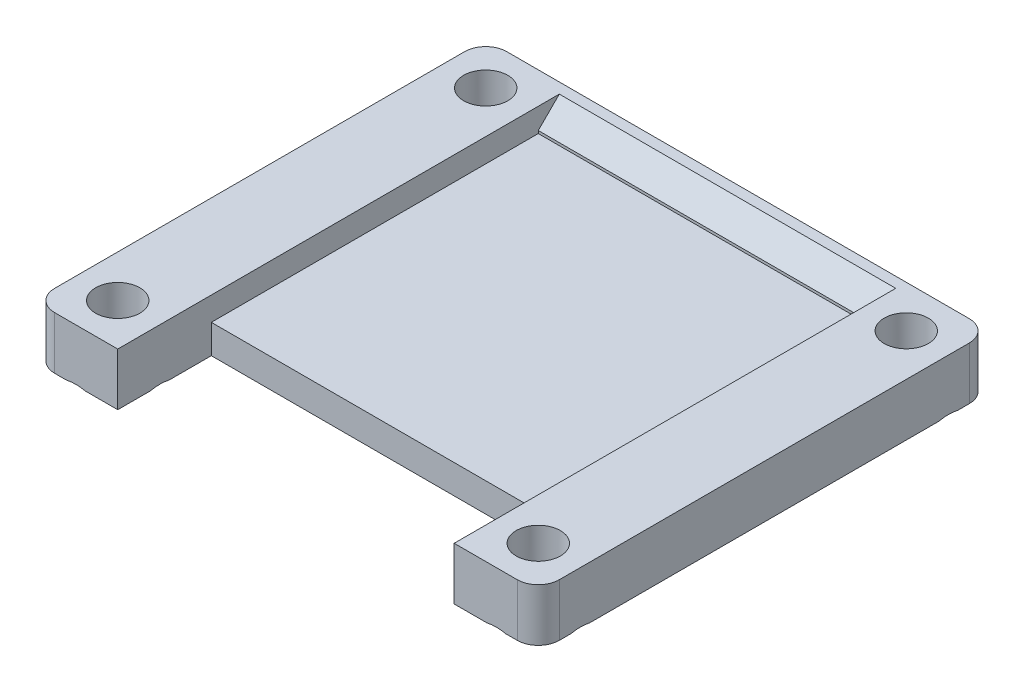
from build123d import *

# Parameters (mm, degrees)
SKETCH_1_W          = 48
SKETCH_1_H          = 43
EXTRUDE_1_DEPTH     = 5
SKETCH_2_W          = 32
SKETCH_2_H          = 40
CUT_EXTRUDE_1_DEPTH = 2.25
SKETCH_3_R          = 2.1
CUT_EXTRUDE_2_DEPTH = 65.637450445
CHAMFER_1_SIZE      = 2
FILLET_1_R          = 2
CHAMFER_2_SIZE      = 2
SKETCH_4_W          = 32
SKETCH_4_H          = 8.9
CUT_EXTRUDE_3_DEPTH = 65.502422435


with BuildPart() as part:
    # Эскиз1 → Бобышка-Вытянуть1 (new body)
    with BuildSketch(Plane(origin=(0, 0, 0), x_dir=(1, 0, 0), z_dir=(0, 1, 0))):
        with Locations((-24, 21.5)):
            Rectangle(SKETCH_1_W, SKETCH_1_H)
    extrude(amount=-EXTRUDE_1_DEPTH)

    # Эскиз2 → Вырез-Вытянуть1 (cut)
    with BuildSketch(Plane(origin=(0, 0, 0), x_dir=(1, 0, 0), z_dir=(0, 1, 0))):
        with Locations((-24, 20)):
            Rectangle(SKETCH_2_W, SKETCH_2_H)
    extrude(amount=-CUT_EXTRUDE_1_DEPTH, mode=Mode.SUBTRACT)

    # Эскиз3 → Вырез-Вытянуть2 (cut, through all)
    with BuildSketch(Plane(origin=(0, 0, 0), x_dir=(1, 0, 0), z_dir=(0, 1, 0))):
        with Locations(Location((-44, 39, 0), (0, 0, 270))):
            Circle(SKETCH_3_R)
        with Locations(Location((-4, 39, 0), (0, 0, 90))):
            Circle(SKETCH_3_R)
        with Locations(Location((-4, 4, 0), (0, 0, 270))):
            Circle(SKETCH_3_R)
        with Locations(Location((-44, 4, 0), (0, 0, 90))):
            Circle(SKETCH_3_R)
    extrude(amount=-CUT_EXTRUDE_2_DEPTH, mode=Mode.SUBTRACT)

    # Фаска1
    # the kernel refuses this chamfer: 2 mm, written as the material it takes off along each edge
    with BuildSketch(Plane(origin=(-44, -5, -4), x_dir=(0, 0, -1), z_dir=(1, 0, 0))) as chamfer_1_piece_1:
        Polygon((2.1 + CHAMFER_1_SIZE, 0), (2.1, CHAMFER_1_SIZE), (2.1, 0), align=None)
    revolve(axis=Axis((-44, -5, -4), (0, 1, 0)), mode=Mode.SUBTRACT)
    with BuildSketch(Plane(origin=(-4, -5, -4), x_dir=(0, 0, 1), z_dir=(-1, 0, 0))) as chamfer_1_piece_2:
        Polygon((2.1 + CHAMFER_1_SIZE, 0), (2.1, CHAMFER_1_SIZE), (2.1, 0), align=None)
    revolve(axis=Axis((-4, -5, -4), (0, 1, 0)), mode=Mode.SUBTRACT)
    with BuildSketch(Plane(origin=(-4, -5, -39), x_dir=(0, 0, -1), z_dir=(1, 0, 0))) as chamfer_1_piece_3:
        Polygon((2.1 + CHAMFER_1_SIZE, 0), (2.1, CHAMFER_1_SIZE), (2.1, 0), align=None)
    revolve(axis=Axis((-4, -5, -39), (0, 1, 0)), mode=Mode.SUBTRACT)
    with BuildSketch(Plane(origin=(-44, -5, -39), x_dir=(0, 0, 1), z_dir=(-1, 0, 0))) as chamfer_1_piece_4:
        Polygon((2.1 + CHAMFER_1_SIZE, 0), (2.1, CHAMFER_1_SIZE), (2.1, 0), align=None)
    revolve(axis=Axis((-44, -5, -39), (0, 1, 0)), mode=Mode.SUBTRACT)

    # Скругление1
    fillet_1_edges = [part.edges().sort_by_distance(p)[0] for p in [
        (-48, -2.5, -43),
        (0, -2.5, -43),
        (0, -2.5, 0),
        (-48, -2.5, 0),
    ]]
    fillet(fillet_1_edges, radius=FILLET_1_R)

    # Фаска2
    chamfer_2_edges = [part.edges().sort_by_distance(p)[0] for p in [
        (-24, 0, -40),
    ]]
    chamfer(chamfer_2_edges, length=CHAMFER_2_SIZE)

    # Эскиз4 → Вырез-Вытянуть3 (cut, through all)
    with BuildSketch(Plane(origin=(0, -2.25, 0), x_dir=(1, 0, 0), z_dir=(0, 1, 0))):
        with Locations((-24, 4.45)):
            Rectangle(SKETCH_4_W, SKETCH_4_H)
    extrude(amount=-CUT_EXTRUDE_3_DEPTH, mode=Mode.SUBTRACT)


solid = part.part
